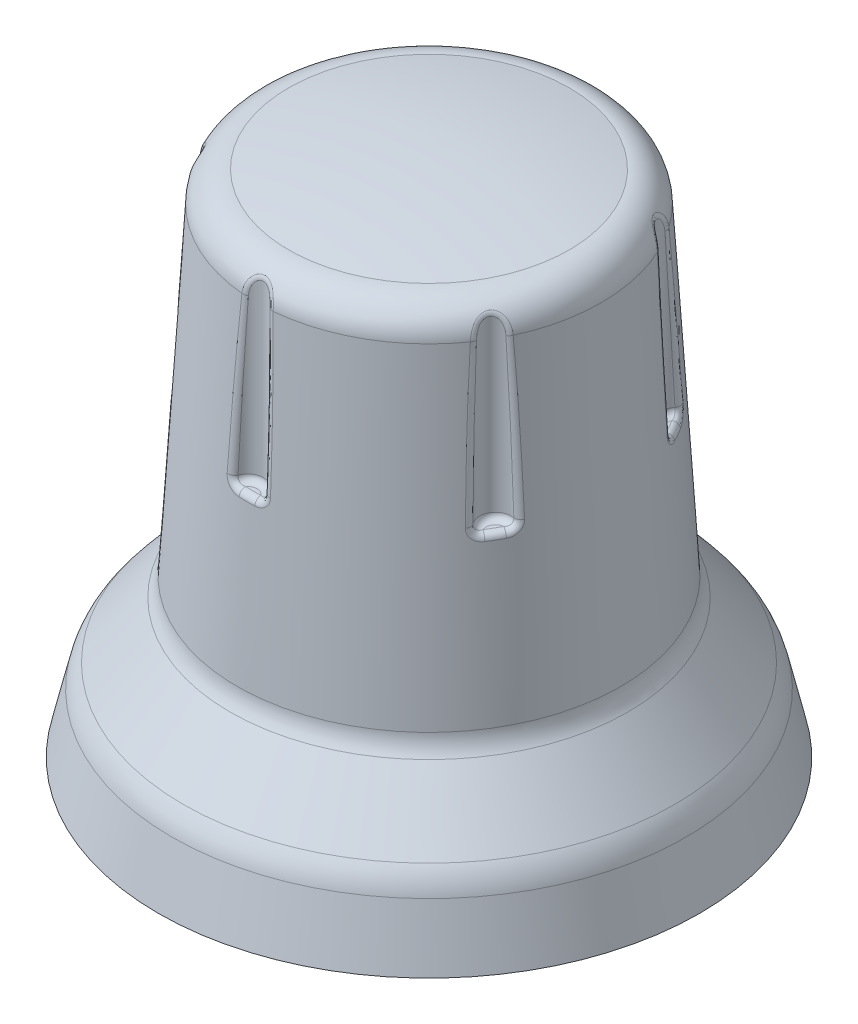
from build123d import *

# Parameters (mm, degrees)
RACCORDO1_R              = 1
RACCORDO2_R              = 1
SCHIZZO2_R               = 0.5
TAGLIO_ESTRUSIONE1_DEPTH = 6
RACCORDO3_R              = 0.2
CUPOLA1_FACE_RADIUS      = 4.408408968
CUPOLA1_HEIGHT           = 0.4
SCHIZZO3_R               = 3
TAGLIO_ESTRUSIONE2_DEPTH = 6


with BuildPart() as part:
    # Schizzo1 → Rivoluzione1 (revolve)
    with BuildSketch(Plane.XY, mode=Mode.PRIVATE) as rivoluzione1_sk:
        with BuildLine():
            Line((0, 0), (8.5, 0))
            Line((8.5, 0), (8.070733472, 1.859357611))
            ThreePointArc((8.070733472, 1.859357611), (7.935879115, 2.236678882), (7.717641305, 2.572728427))
            Line((7.717641305, 2.572728427), (6.036514688, 4.6))
            Line((6.036514688, 4.6), (5.35, 16))
            Line((5.35, 16), (0, 16))
            Line((0, 16), (0, 0))
        make_face()
    revolve(rivoluzione1_sk.sketch.rotate(Axis((0, 36.994957287, 0), (0, -1, 0)), 90), axis=Axis((0, 36.994957287, 0), (0, -1, 0)))

    # Raccordo1
    raccordo1_edges = [part.edges().sort_by_distance(p)[0] for p in [
        (0, 4.6, -6.036514688),
    ]]
    fillet(raccordo1_edges, radius=RACCORDO1_R)

    # Raccordo2
    raccordo2_edges = [part.edges().sort_by_distance(p)[0] for p in [
        (0, 16, -5.35),
    ]]
    fillet(raccordo2_edges, radius=RACCORDO2_R)

    # Schizzo2 → Taglio-Estrusione1 (cut)
    with BuildSketch(Plane(origin=(0, 16, 0), x_dir=(1, 0, 0), z_dir=(0, 1, 0))):
        with Locations((0, 5.7)):
            Circle(SCHIZZO2_R)
        with Locations((4.936344802, 2.85)):
            Circle(SCHIZZO2_R)
        with Locations((4.936344802, -2.85)):
            Circle(SCHIZZO2_R)
        with Locations((0, -5.7)):
            Circle(SCHIZZO2_R)
        with Locations((-4.936344802, -2.85)):
            Circle(SCHIZZO2_R)
        with Locations((-4.936344802, 2.85)):
            Circle(SCHIZZO2_R)
    extrude(amount=-TAGLIO_ESTRUSIONE1_DEPTH, mode=Mode.SUBTRACT)

    # Raccordo3
    raccordo3_edges = [part.edges().sort_by_distance(p)[0] for p in [
        (4.503332097, 15.61105125, -2.599999999),
        (4.503332097, 15.61105125, 2.599999999),
        (-0.305507512, 15.426319896, 5.304190502),
        (-4.503332097, 15.61105125, 2.599999999),
        (-4.503332097, 15.611051248, -2.599999998),
        (0, 15.61105125, -5.199999997),
        (4.946151258, 10, -2.85566176),
        (4.946151258, 10, 2.85566176),
        (-0.250184017, 10, 5.705841245),
        (-4.946151258, 10, 2.85566176),
        (-4.946151258, 10, -2.85566176),
        (0, 10, -5.71132352),
        (-0.473285114, 12.53049808, -5.538751161),
        (0, 10, -5.2),
        (0.47328513, 12.53049808, -5.538751161),
        (-5.033341776, 12.53049808, -2.359498635),
        (-4.5033321, 10, -2.6),
        (-4.560056654, 12.53049808, -3.179252513),
        (-4.560056646, 12.53049808, 3.179252526),
        (-4.5033321, 10, 2.6),
        (-5.033341768, 12.53049808, 2.359498649),
        (0.473285114, 12.53049808, 5.538751161),
        (0, 10, 5.2),
        (-0.473285129, 12.53049808, 5.538751161),
        (5.033341768, 12.53049808, 2.359498649),
        (4.5033321, 10, 2.6),
        (4.560056654, 12.53049808, 3.179252513),
        (4.560056654, 12.53049808, -3.179252513),
        (4.5033321, 10, -2.6),
        (5.033341776, 12.53049808, -2.359498635),
    ]]
    fillet(raccordo3_edges, radius=RACCORDO3_R)

    # Cupola1: a dome of height H over a round flat face of radius A is a cap of a sphere of radius (A * A + H * H) / (2 * H)
    cupola1_r = (CUPOLA1_FACE_RADIUS * CUPOLA1_FACE_RADIUS + CUPOLA1_HEIGHT * CUPOLA1_HEIGHT) / (2 * CUPOLA1_HEIGHT)
    cupola1_base = Plane((0, 16, 0), z_dir=(0, 1, 0))
    with Locations(cupola1_base.offset(CUPOLA1_HEIGHT - cupola1_r)):
        cupola1_ball = Sphere(cupola1_r, mode=Mode.PRIVATE)
    add(split(cupola1_ball, bisect_by=cupola1_base, keep=Keep.TOP, mode=Mode.PRIVATE))

    # Schizzo3 → Taglio-Estrusione2 (cut)
    with BuildSketch(Plane.XZ):
        with Locations(Location((0, 0, 0), (0, 0, 270))):
            Circle(SCHIZZO3_R)
    extrude(amount=-TAGLIO_ESTRUSIONE2_DEPTH, mode=Mode.SUBTRACT)


solid = part.part
